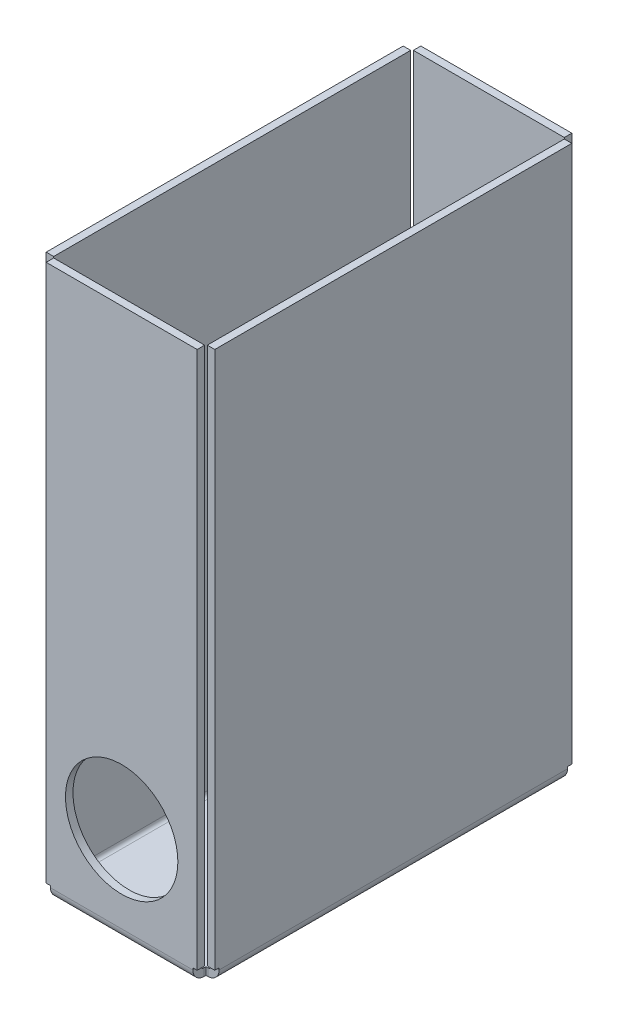
from build123d import *

# Parameters (mm, degrees)
SKETCH7_W              = 45
SKETCH7_H              = 100
BOSS_EXTRUDE1_DEPTH    = 147
SHELL1_T               = -2
CONVERT_SOLID1_START   = -1
CONVERT_SOLID1_DEPTH   = 3.353553391
CONVERT_SOLID1_START_2 = 42.646446609
CONVERT_SOLID1_2_DEPTH = 3.353553391
CONVERT_SOLID1_START_3 = 2.353553391
CONVERT_SOLID1_3_DEPTH = 40.292893218
CONVERT_SOLID1_4_DEPTH = 1.146446609
CONVERT_SOLID1_START_4 = 41.5
CONVERT_SOLID1_5_DEPTH = 1.146446609
CONVERT_SOLID1_START_5 = 3.5
CONVERT_SOLID1_6_DEPTH = 38
CONVERT_SOLID1_START_6 = -96.5
CONVERT_SOLID1_7_DEPTH = 93
CONVERT_SOLID1_8_DEPTH = 93
SKETCH13_R             = 15
CUT_EXTRUDE1_DEPTH     = 10
SKETCH14_R             = 4
CUT_EXTRUDE2_DEPTH     = 10
SKETCH15_R             = 7.5
CUT_EXTRUDE3_DEPTH     = 10


with BuildPart() as part:
    # Sketch7 → Boss-Extrude1 (new body)
    with BuildSketch(Plane(origin=(0, 0, 0), x_dir=(1, 0, 0), z_dir=(0, 1, 0))):
        with Locations((22.5, 50)):
            Rectangle(SKETCH7_W, SKETCH7_H)
    extrude(amount=BOSS_EXTRUDE1_DEPTH)

    # Shell1
    shell1_openings = [part.faces().sort_by_distance(p)[0] for p in [
        (22.5, 147, -50),
    ]]
    offset(amount=SHELL1_T, openings=shell1_openings, kind=Kind.INTERSECTION)

    # Convert-Solid1: read off the stored shape, not the designer's step
    # Convert-Solid1 outline → Convert-Solid1 (cut)
    with BuildSketch(Plane.YZ.offset(CONVERT_SOLID1_START)):
        Polygon((147, -100), (147, -97.646446609), (3.5, -97.646446609), (3.5, -96.5), (0, -96.5), (0, -100), align=None)
        Polygon((147, -2.353553391), (147, 0), (0, 0), (0, -3.5), (3.5, -3.5), (3.5, -2.353553391), align=None)
    extrude(amount=CONVERT_SOLID1_DEPTH, mode=Mode.SUBTRACT)

    # Convert-Solid1 2 outline → Convert-Solid1 2 (cut)
    with BuildSketch(Plane.YZ.offset(CONVERT_SOLID1_START_2)):
        Polygon((147, -100), (147, -97.646446609), (3.5, -97.646446609), (3.5, -96.5), (0, -96.5), (0, -100), align=None)
        Polygon((147, -2.353553391), (147, 0), (0, 0), (0, -3.5), (3.5, -3.5), (3.5, -2.353553391), align=None)
    extrude(amount=CONVERT_SOLID1_2_DEPTH, mode=Mode.SUBTRACT)

    # Convert-Solid1 3 outline → Convert-Solid1 3 (cut)
    with BuildSketch(Plane.YZ.offset(CONVERT_SOLID1_START_3)):
        with BuildLine():
            ThreePointArc((3, -100), (0.878679656, -99.121320344), (0, -97))
            Line((0, -97), (0, -100))
            Line((0, -100), (3, -100))
        make_face()
        with BuildLine():
            Line((0, 0), (0, -3))
            ThreePointArc((0, -3), (0.878679656, -0.878679656), (3, 0))
            Line((3, 0), (0, 0))
        make_face()
    extrude(amount=CONVERT_SOLID1_3_DEPTH, mode=Mode.SUBTRACT)

    # Convert-Solid1 4 outline → Convert-Solid1 4 (cut)
    with BuildSketch(Plane.YZ.offset(CONVERT_SOLID1_START_3)):
        with BuildLine():
            Line((2, -98), (2, -96.5))
            Line((2, -96.5), (0, -96.5))
            Line((0, -96.5), (0, -97))
            ThreePointArc((0, -97), (0.878679656, -99.121320344), (3, -100))
            Line((3, -100), (3.5, -100))
            Line((3.5, -100), (3.5, -98))
            Line((3.5, -98), (2, -98))
        make_face()
        with BuildLine():
            Line((0, -3.5), (2, -3.5))
            Line((2, -3.5), (2, -2))
            Line((2, -2), (3.5, -2))
            Line((3.5, -2), (3.5, 0))
            Line((3.5, 0), (3, 0))
            ThreePointArc((3, 0), (0.878679656, -0.878679656), (0, -3))
            Line((0, -3), (0, -3.5))
        make_face()
    extrude(amount=CONVERT_SOLID1_4_DEPTH, mode=Mode.SUBTRACT)

    # Convert-Solid1 5 outline → Convert-Solid1 5 (cut)
    with BuildSketch(Plane.YZ.offset(CONVERT_SOLID1_START_4)):
        with BuildLine():
            Line((2, -98), (2, -96.5))
            Line((2, -96.5), (0, -96.5))
            Line((0, -96.5), (0, -97))
            ThreePointArc((0, -97), (0.878679656, -99.121320344), (3, -100))
            Line((3, -100), (3.5, -100))
            Line((3.5, -100), (3.5, -98))
            Line((3.5, -98), (2, -98))
        make_face()
        with BuildLine():
            Line((0, -3.5), (2, -3.5))
            Line((2, -3.5), (2, -2))
            Line((2, -2), (3.5, -2))
            Line((3.5, -2), (3.5, 0))
            Line((3.5, 0), (3, 0))
            ThreePointArc((3, 0), (0.878679656, -0.878679656), (0, -3))
            Line((0, -3), (0, -3.5))
        make_face()
    extrude(amount=CONVERT_SOLID1_5_DEPTH, mode=Mode.SUBTRACT)

    # Convert-Solid1 6 outline → Convert-Solid1 6 (add)
    with BuildSketch(Plane.YZ.offset(CONVERT_SOLID1_START_5)):
        with BuildLine():
            ThreePointArc((3, -98), (2.292893219, -97.707106781), (2, -97))
            Line((2, -97), (2, -98))
            Line((2, -98), (3, -98))
        make_face()
        with BuildLine():
            Line((2, -2), (2, -3))
            ThreePointArc((2, -3), (2.292893219, -2.292893219), (3, -2))
            Line((3, -2), (2, -2))
        make_face()
    extrude(amount=CONVERT_SOLID1_6_DEPTH)

    # Convert-Solid1 7 outline → Convert-Solid1 7 (cut)
    with BuildSketch(Plane.XY.offset(CONVERT_SOLID1_START_6)):
        with BuildLine():
            Line((45, 0), (45, 3))
            ThreePointArc((45, 3), (44.121320344, 0.878679656), (42, 0))
            Line((42, 0), (45, 0))
        make_face()
        with BuildLine():
            Line((0, 0), (3, 0))
            ThreePointArc((3, 0), (0.878679656, 0.878679656), (0, 3))
            Line((0, 3), (0, 0))
        make_face()
    extrude(amount=CONVERT_SOLID1_7_DEPTH, mode=Mode.SUBTRACT)

    # Convert-Solid1 8 outline → Convert-Solid1 8 (add)
    with BuildSketch(Plane.XY.offset(CONVERT_SOLID1_START_6)):
        with BuildLine():
            Line((43, 2), (43, 3))
            ThreePointArc((43, 3), (42.707106781, 2.292893219), (42, 2))
            Line((42, 2), (43, 2))
        make_face()
        with BuildLine():
            Line((2, 2), (3, 2))
            ThreePointArc((3, 2), (2.292893219, 2.292893219), (2, 3))
            Line((2, 3), (2, 2))
        make_face()
    extrude(amount=CONVERT_SOLID1_8_DEPTH)

    # Sketch13 → Cut-Extrude1 (cut)
    with BuildSketch(Plane.XY):
        with Locations((22.5, 26)):
            Circle(SKETCH13_R)
    extrude(amount=-CUT_EXTRUDE1_DEPTH, mode=Mode.SUBTRACT)

    # Sketch14 → Cut-Extrude2 (cut)
    with BuildSketch(Plane(origin=(0, 0, -100), x_dir=(-1, 0, 0), z_dir=(0, 0, -1))):
        with Locations((-22, 26)):
            Circle(SKETCH14_R)
    extrude(amount=-CUT_EXTRUDE2_DEPTH, mode=Mode.SUBTRACT)

    # Sketch15 → Cut-Extrude3 (cut)
    with BuildSketch(Plane(origin=(0, 0, -100), x_dir=(-1, 0, 0), z_dir=(0, 0, -1))):
        with Locations((-22, 97)):
            Circle(SKETCH15_R)
    extrude(amount=-CUT_EXTRUDE3_DEPTH, mode=Mode.SUBTRACT)


solid = part.part
